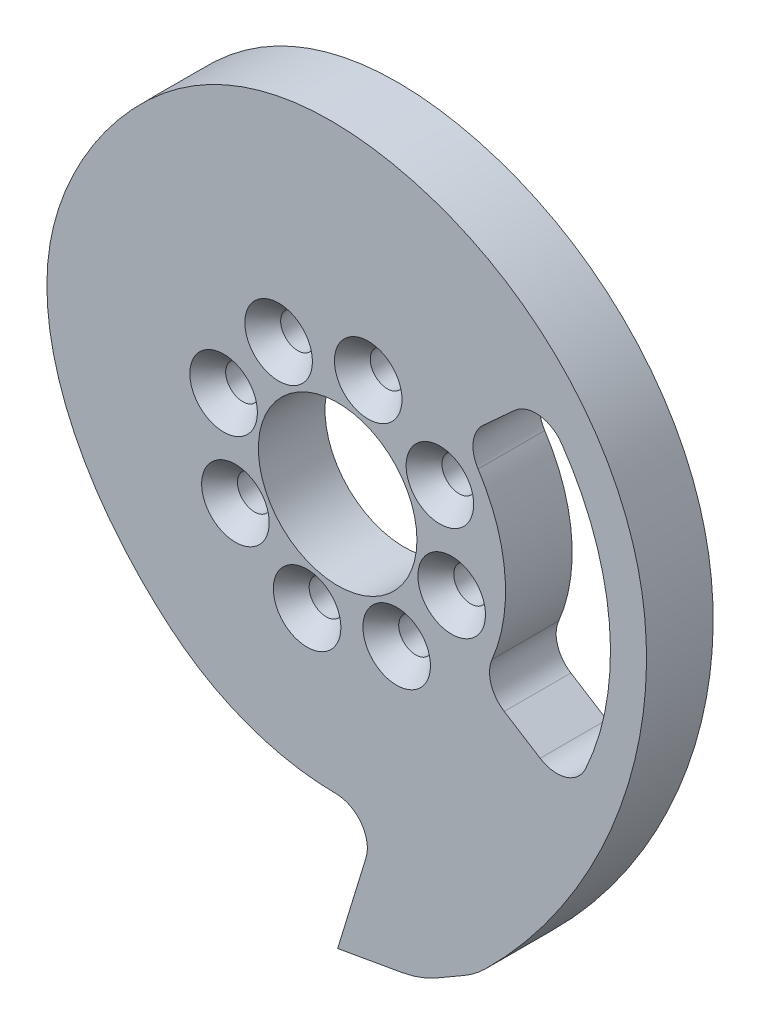
from build123d import *
from OCP.BRepFilletAPI import BRepFilletAPI_MakeFillet

# Parameters (mm, degrees)
SKETCH1_R                                        = 15.1125
BOSS_EXTRUDE1_DEPTH                              = 12.7
FILLET1_R1                                       = 6
FILLET1_R2                                       = 20
CUT_EXTRUDE1_DEPTH                               = 97.187316036
FILLET2_R                                        = 6
CSK_FOR_1_4_FLAT_HEAD_MACHINE_SCREW1_D           = 6.5278
CSK_FOR_1_4_FLAT_HEAD_MACHINE_SCREW1_DEPTH       = 54.11
CSK_FOR_1_4_FLAT_HEAD_MACHINE_SCREW1_CSINK_D     = 12.8778
CSK_FOR_1_4_FLAT_HEAD_MACHINE_SCREW1_CSINK_ANGLE = 82
CSK_FOR_1_4_FLAT_HEAD_MACHINE_SCREW1_TIP         = 1.961148974


with BuildPart() as part:
    # Sketch1 → Boss-Extrude1 (new body)
    with BuildSketch(Plane.XY):
        with BuildLine():
            ThreePointArc((-31.88226544, -37.995804379), (-13.155899314, -47.823449407), (7.962221644, -48.956746486))
            Line((7.962221644, -48.956746486), (0, -75))
            Line((0, -75), (15.756924048, -72.221629157))
            Line((15.756924048, -72.221629157), (26.149228894, -66.221629157))
            add(Edge.make_bspline(
                [(26.149228894, -66.221629157), (51.375242172, -42.5711118), (73.155327324, 16.265957691), (24.786084456, 64.170295229), (-29.726149903, 61.426673461), (-65.053373901, 8.823513537), (-48.308937171, -24.212190188), (-31.88226544, -37.995804379)],
                knots=[0, 0, 0, 0, 0.320521396, 0.565793749, 0.734822836, 0.843782163, 1, 1, 1, 1], degree=3))
        make_face()
        Circle(SKETCH1_R, mode=Mode.SUBTRACT)
    extrude(amount=BOSS_EXTRUDE1_DEPTH)

    # Fillet1: one fillet with a radius per group of edges: ONE call of the kernel's fillet builder (fillet() takes one radius for all edges)
    fillet1_edges_1 = [part.edges().sort_by_distance(p)[0] for p in [
        (7.962221644, -48.956746486, 6.35),
    ]]
    fillet1_edges_2 = [part.edges().sort_by_distance(p)[0] for p in [
        (15.756924048, -72.221629157, 6.35),
        (26.149228894, -66.221629157, 6.35),
    ]]
    fillet1 = BRepFilletAPI_MakeFillet(part.part.solid().wrapped)
    for e in fillet1_edges_1:
        fillet1.Add(FILLET1_R1, e.wrapped)
    for e in fillet1_edges_2:
        fillet1.Add(FILLET1_R2, e.wrapped)
    add(Compound.cast(fillet1.Shape()), mode=Mode.REPLACE)

    # Sketch2 → Cut-Extrude1 (cut, through all)
    with BuildSketch(Plane.XY.offset(12.7)):
        with BuildLine():
            Line((38.459406213, 34.998201007), (23.6673269, 21.537354466))
            ThreePointArc((23.6673269, 21.537354466), (31.875670784, 2.818086599), (27.078868652, -17.050949314))
            Line((27.078868652, -17.050949314), (44.00316156, -27.707792636))
            ThreePointArc((44.00316156, -27.707792636), (51.797965024, 4.579390723), (38.459406213, 34.998201007))
        make_face()
    extrude(amount=-CUT_EXTRUDE1_DEPTH, mode=Mode.SUBTRACT)

    # Fillet2
    fillet2_edges = [part.edges().sort_by_distance(p)[0] for p in [
        (27.078868652, -17.050949314, 6.35),
        (38.459406213, 34.998201007, 6.35),
        (44.00316156, -27.707792636, 6.35),
        (23.6673269, 21.537354466, 6.35),
    ]]
    fillet(fillet2_edges, radius=FILLET2_R)

    # CSK for 1/4 Flat Head Machine Screw1
    with Locations(Plane.XY.offset(12.7)):
        with Locations((19.485571585, 11.25), (21.733331092, -5.823428515), (11.25, -19.485571585), (-5.823428515, -21.733331092), (-11.25, 19.485571585), (5.823428515, 21.733331092), (-19.485571585, -11.25), (-21.733331092, 5.823428515)):
            CounterSinkHole(CSK_FOR_1_4_FLAT_HEAD_MACHINE_SCREW1_D / 2, CSK_FOR_1_4_FLAT_HEAD_MACHINE_SCREW1_CSINK_D / 2, depth=CSK_FOR_1_4_FLAT_HEAD_MACHINE_SCREW1_DEPTH, counter_sink_angle=CSK_FOR_1_4_FLAT_HEAD_MACHINE_SCREW1_CSINK_ANGLE)
            with Locations((0, 0, -(CSK_FOR_1_4_FLAT_HEAD_MACHINE_SCREW1_DEPTH + CSK_FOR_1_4_FLAT_HEAD_MACHINE_SCREW1_TIP / 2))):  # 118° drill point
                Cone(0, CSK_FOR_1_4_FLAT_HEAD_MACHINE_SCREW1_D / 2, CSK_FOR_1_4_FLAT_HEAD_MACHINE_SCREW1_TIP, mode=Mode.SUBTRACT)


solid = part.part
